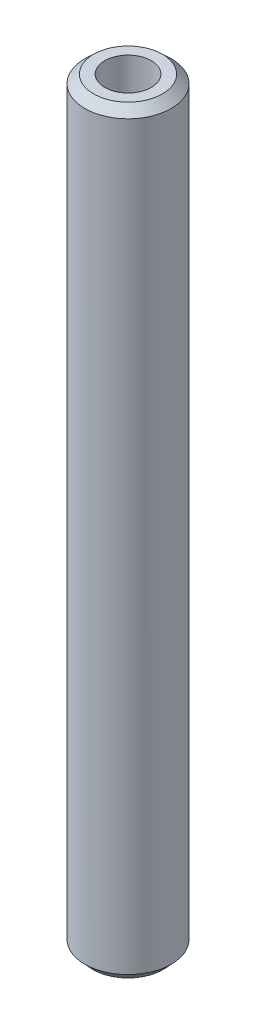
from build123d import *
from OCP.BRepFilletAPI import BRepFilletAPI_MakeChamfer

# Parameters (mm, degrees)
SKETCH1_R           = 20
BOSS_EXTRUDE1_DEPTH = 351.146910129
SKETCH2_R           = 10.767078484
CUT_EXTRUDE1_DEPTH  = 353.284192795
CHAMFER1_SIZE       = 3.8208882
CHAMFER1_SIZE2      = 4.067651844


with BuildPart() as part:
    # Sketch1 → Boss-Extrude1 (new body)
    with BuildSketch(Plane(origin=(0, 0, 0), x_dir=(1, 0, 0), z_dir=(0, 1, 0))):
        Circle(SKETCH1_R)
    extrude(amount=BOSS_EXTRUDE1_DEPTH)

    # Sketch2 → Cut-Extrude1 (cut, through all)
    with BuildSketch(Plane(origin=(0, 0, 0), x_dir=(1, 0, 0), z_dir=(0, 1, 0))):
        Circle(SKETCH2_R)
    extrude(amount=CUT_EXTRUDE1_DEPTH, mode=Mode.SUBTRACT)

    # Chamfer1: one chamfer whose edges measure the first distance from different faces: ONE call of the kernel's chamfer builder (chamfer() names one face for all edges)
    chamfer1_edges_1 = [part.edges().sort_by_distance(p)[0] for p in [
        (-20, 351.146910129, 0),
    ]]
    chamfer1_side_1 = [part.faces().sort_by_distance(p)[0] for p in [
        (-20, 175.573455064, 0),
    ]]
    chamfer1_edges_2 = [part.edges().sort_by_distance(p)[0] for p in [
        (-20, 0, 0),
    ]]
    chamfer1_side_2 = [part.faces().sort_by_distance(p)[0] for p in [
        (-19.434314575, 0, 0),
    ]]
    chamfer1 = BRepFilletAPI_MakeChamfer(part.part.solid().wrapped)
    for e in chamfer1_edges_1:
        chamfer1.Add(CHAMFER1_SIZE, CHAMFER1_SIZE2, e.wrapped, chamfer1_side_1[0].wrapped)  # the first distance lies on this face
    for e in chamfer1_edges_2:
        chamfer1.Add(CHAMFER1_SIZE, CHAMFER1_SIZE2, e.wrapped, chamfer1_side_2[0].wrapped)  # the first distance lies on this face
    add(Compound.cast(chamfer1.Shape()), mode=Mode.REPLACE)


solid = part.part
